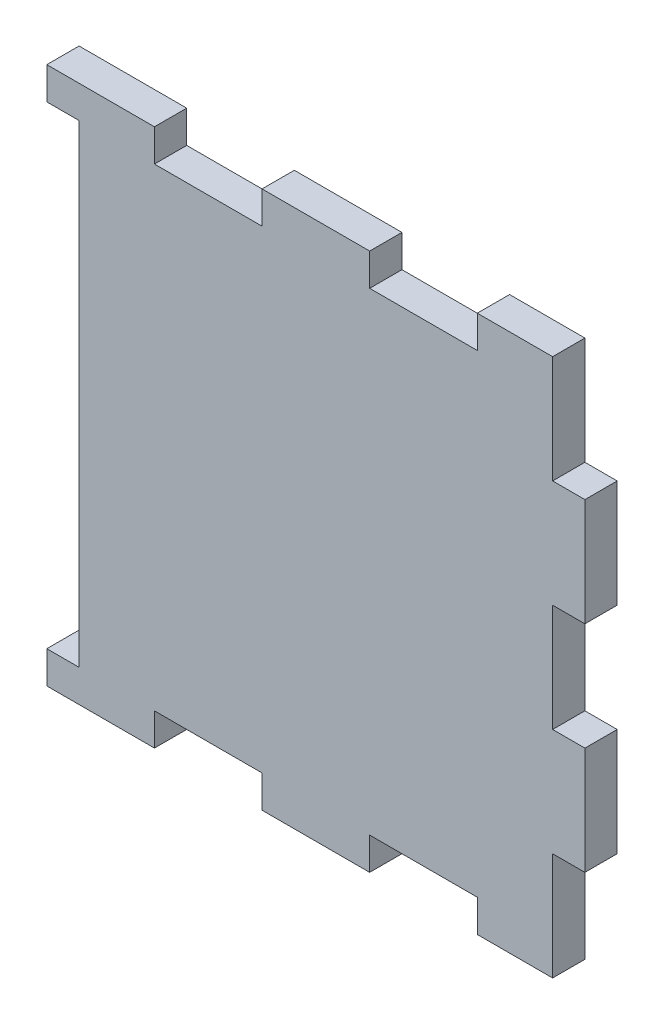
from build123d import *

# Parameters (mm, degrees)
SKETCH1_W           = 50
SKETCH1_H           = 50
BOSS_EXTRUDE1_DEPTH = 3
SKETCH2_W           = 10
SKETCH2_H           = 3
SKETCH2_W_2         = 3
SKETCH2_H_2         = 10
CUT_EXTRUDE1_DEPTH  = 3
CAVITY1_START       = -22
CAVITY1_OUTLINE_W   = 3
CAVITY1_OUTLINE_H   = 3
CAVITY1_DEPTH       = 44


# Read off the part's stored shape, not the designer's step: Cavity1
with BuildPart() as part:
    # Sketch1 → Boss-Extrude1 (new body)
    with BuildSketch(Plane.XY):
        Rectangle(SKETCH1_W, SKETCH1_H)
    extrude(amount=BOSS_EXTRUDE1_DEPTH)

    # Sketch2 → Cut-Extrude1 (cut)
    with BuildSketch(Plane.XY.offset(3)):
        with Locations((-10, 23.5)):
            Rectangle(SKETCH2_W, SKETCH2_H)
        with Locations((10, 23.5)):
            Rectangle(SKETCH2_W, SKETCH2_H)
        with Locations((10, -23.5)):
            Rectangle(SKETCH2_W, SKETCH2_H)
        with Locations((-10, -23.5)):
            Rectangle(SKETCH2_W, SKETCH2_H)
        with Locations((23.5, 20)):
            Rectangle(SKETCH2_W_2, SKETCH2_H_2)
        with Locations((23.5, -20)):
            Rectangle(SKETCH2_W_2, SKETCH2_H_2)
        with Locations((23.5, 0)):
            Rectangle(SKETCH2_W_2, SKETCH2_H_2)
    extrude(amount=-CUT_EXTRUDE1_DEPTH, mode=Mode.SUBTRACT)

    # Cavity1 outline → Cavity1 (cut)
    with BuildSketch(Plane(origin=(0, 0, 0), x_dir=(1, 0, 0), z_dir=(0, 1, 0)).offset(CAVITY1_START)):
        with Locations((-23.5, -1.5)):
            Rectangle(CAVITY1_OUTLINE_W, CAVITY1_OUTLINE_H)
    extrude(amount=CAVITY1_DEPTH, mode=Mode.SUBTRACT)


solid = part.part
